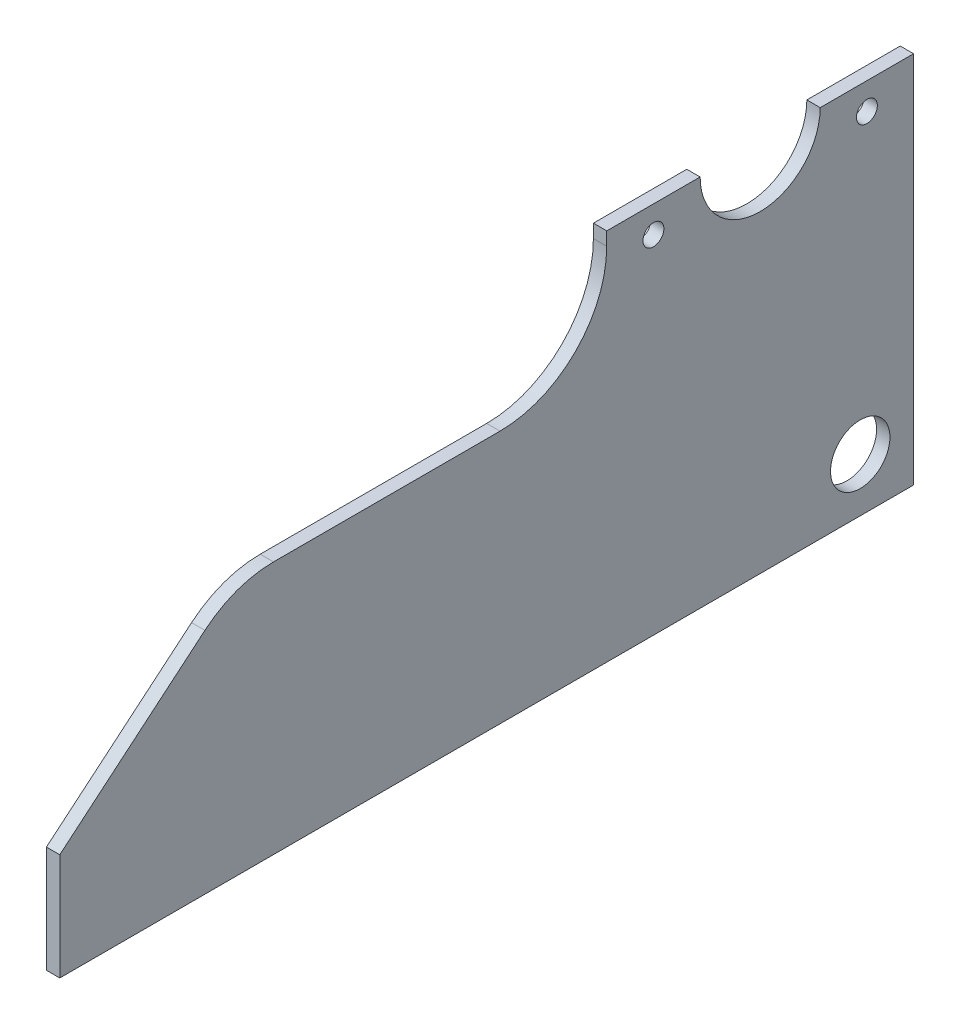
from build123d import *

# Parameters (mm, degrees)
BOSS_EXTRUDE1_DEPTH    = 3.175
F_10_CLEARANCE_HOLE1_D = 4.9784
SKETCH9_R              = 7.0739
CUT_EXTRUDE1_DEPTH     = 209.029140086


with BuildPart() as part:
    # Sketch1 → Boss-Extrude1 (new body)
    with BuildSketch(Plane(origin=(0, 0, 0), x_dir=(0, 0, -1), z_dir=(1, 0, 0))):
        with BuildLine():
            Line((0, -44.45), (0, 44.45))
            Line((0, 44.45), (-22.225, 44.45))
            ThreePointArc((-22.225, 44.45), (-36.5125, 30.1625), (-50.8, 44.45))
            Line((-50.8, 44.45), (-73.025, 44.45))
            Line((-73.025, 44.45), (-73.025, 41.275))
            ThreePointArc((-73.025, 41.275), (-80.464487758, 23.314487758), (-98.425, 15.875))
            Line((-98.425, 15.875), (-152.333161828, 15.875))
            ThreePointArc((-152.333161828, 15.875), (-161.020473469, 14.343192568), (-168.659967114, 9.932528855))
            Line((-168.659967114, 9.932528855), (-203.2, -19.05))
            Line((-203.2, -19.05), (-203.2, -44.45))
            Line((-203.2, -44.45), (0, -44.45))
        make_face()
    extrude(amount=BOSS_EXTRUDE1_DEPTH)

    # #10 Clearance Hole1 (through all)
    with Locations(Plane(origin=(3.175, 0, 0), x_dir=(0, 0, -1), z_dir=(1, 0, 0))):
        with Locations((-61.9125, 38.1), (-11.1125, 38.1)):
            Hole(F_10_CLEARANCE_HOLE1_D / 2)

    # Sketch9 → Cut-Extrude1 (cut, through all)
    with BuildSketch(Plane(origin=(3.175, 0, 0), x_dir=(0, 0, -1), z_dir=(1, 0, 0))):
        with Locations((-12.7, -31.75)):
            Circle(SKETCH9_R)
    extrude(amount=-CUT_EXTRUDE1_DEPTH, mode=Mode.SUBTRACT)


solid = part.part
